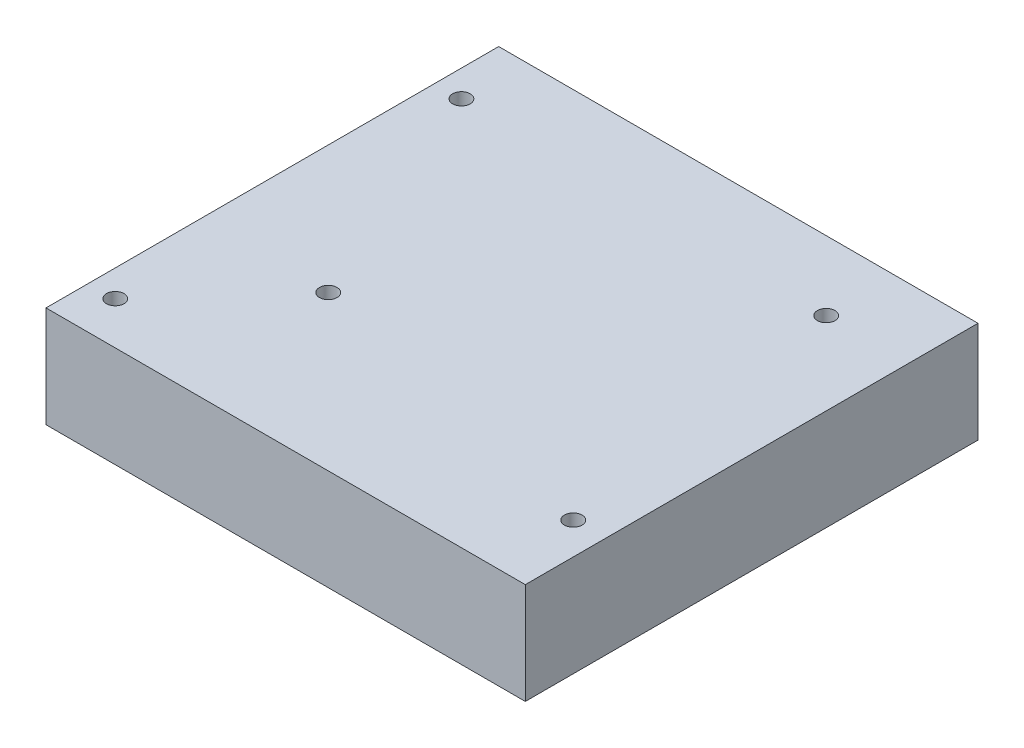
from build123d import *

# Parameters (mm, degrees)
SKETCH1_W           = 90
SKETCH1_H           = 85
SKETCH1_R           = 1.65
BOSS_EXTRUDE1_DEPTH = 19


with BuildPart() as part:
    # Sketch1 → Boss-Extrude1 (new body)
    with BuildSketch(Plane(origin=(0, 0, 0), x_dir=(1, 0, 0), z_dir=(0, 1, 0))):
        with Locations((45, 42.5)):
            Rectangle(SKETCH1_W, SKETCH1_H)
        with Locations((5, 73)):
            Circle(SKETCH1_R, mode=Mode.SUBTRACT)
        with Locations((5, 8)):
            Circle(SKETCH1_R, mode=Mode.SUBTRACT)
        with Locations((84, 15)):
            Circle(SKETCH1_R, mode=Mode.SUBTRACT)
        with Locations((24, 29)):
            Circle(SKETCH1_R, mode=Mode.SUBTRACT)
        with Locations((74.5, 72)):
            Circle(SKETCH1_R, mode=Mode.SUBTRACT)
    extrude(amount=BOSS_EXTRUDE1_DEPTH)


solid = part.part
